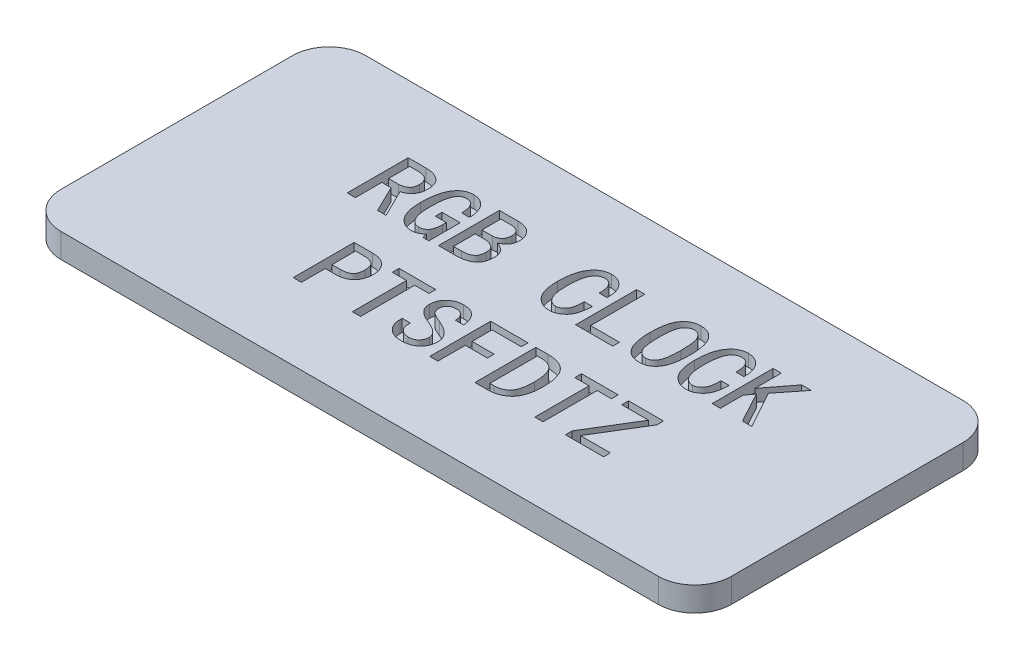
from build123d import *

# Parameters (mm, degrees)
EXTRUDE_1_DEPTH     = 4
CUT_EXTRUDE_1_DEPTH = 2
SKETCH_3_R          = 1.55
CUT_EXTRUDE_2_DEPTH = 2


with BuildPart() as part:
    # 草图1 → 凸台-拉伸1 (new body)
    with BuildSketch(Plane(origin=(0, 0, 0), x_dir=(1, 0, 0), z_dir=(0, 1, 0))):
        with BuildLine():
            Line((-49.060103211, -24.953020455), (48.939896789, -24.953020455))
            ThreePointArc((48.939896789, -24.953020455), (53.182537476, -23.195661143), (54.939896789, -18.953020455))
            Line((54.939896789, -18.953020455), (54.939896789, 19.046979545))
            ThreePointArc((54.939896789, 19.046979545), (53.182537476, 23.289620232), (48.939896789, 25.046979545))
            Line((48.939896789, 25.046979545), (-49.060103211, 25.046979545))
            ThreePointArc((-49.060103211, 25.046979545), (-53.302743898, 23.289620232), (-55.060103211, 19.046979545))
            Line((-55.060103211, 19.046979545), (-55.060103211, -18.953020455))
            ThreePointArc((-55.060103211, -18.953020455), (-53.302743898, -23.195661143), (-49.060103211, -24.953020455))
        make_face()
    extrude(amount=EXTRUDE_1_DEPTH)

    # 草图2 → 切除-拉伸1 (cut)
    # profile 1 of 15: a face of its own
    with BuildSketch(Plane(origin=(0, 4, 0), x_dir=(1, 0, 0), z_dir=(0, 1, 0))):
        with BuildLine():
            Line((-24.689103402, 4.013286342), (-26.092612174, 4.013286342))
            Line((-26.092612174, 4.013286342), (-28.197875332, 8.340771722))
            Line((-28.197875332, 8.340771722), (-29.718343168, 8.340771722))
            Line((-29.718343168, 8.340771722), (-29.718343168, 4.013286342))
            Line((-29.718343168, 4.013286342), (-31.063372408, 4.013286342))
            Line((-31.063372408, 4.013286342), (-31.063372408, 14.013286342))
            Line((-31.063372408, 14.013286342), (-28.139395799, 14.013286342))
            add(Edge.make_bspline(
                [(-28.139395799, 14.013286342), (-28.025271199, 14.011022447), (-27.801665177, 14.006586764), (-27.474158532, 13.977305773), (-27.163811789, 13.922480888), (-26.869993583, 13.848543864), (-26.591122472, 13.757128365), (-26.330664058, 13.638152685), (-26.084604122, 13.502366925), (-25.856059717, 13.34436888), (-25.649198765, 13.162867164), (-25.468095095, 12.953694485), (-25.317506234, 12.71659107), (-25.19224016, 12.453536513), (-25.098862257, 12.163974849), (-25.028759565, 11.848745919), (-24.988061601, 11.506955486), (-24.983731739, 11.269910871), (-24.981501063, 11.147789266)],
                knots=[0, 0, 0, 0, 1.124851401, 2.203938021, 3.236923468, 4.227547377, 5.188384515, 6.124748074, 7.04535131, 7.955333121, 8.85768773, 9.750678987, 10.67246398, 11.61778816, 12.61462837, 13.664292026, 14.796680505, 16, 16, 16, 16], degree=3))
            add(Edge.make_bspline(
                [(-24.981501063, 11.147789266), (-24.982879235, 11.053132412), (-24.985568475, 10.868427619), (-25.014691702, 10.599897587), (-25.059459648, 10.347780009), (-25.122091088, 10.111878008), (-25.20381367, 9.892229091), (-25.306953951, 9.68976788), (-25.425462329, 9.502309698), (-25.607220143, 9.280192442), (-25.858260009, 9.03978442), (-26.186011564, 8.801825154), (-26.537419989, 8.621484855), (-26.787121493, 8.551180459), (-26.911325624, 8.516210319)],
                knots=[0, 0, 0, 0, 0.960252019, 1.873748618, 2.737466876, 3.556786617, 4.347431233, 5.110891588, 5.858830743, 6.593445102, 8.018399741, 9.372640647, 10.693124067, 12, 12, 12, 12], degree=3))
            Line((-26.911325624, 8.516210319), (-24.689103402, 4.013286342))
        make_face()
        with BuildLine():
            add(Edge.make_bspline(
                [(-26.326530302, 11.147789266), (-26.328534479, 11.214250313), (-26.332444587, 11.343914494), (-26.352988156, 11.533501173), (-26.392896046, 11.711592998), (-26.445391927, 11.879642896), (-26.519630989, 12.033952382), (-26.602039127, 12.180903159), (-26.706758189, 12.313205167), (-26.822926271, 12.438010916), (-26.958258394, 12.548784835), (-27.112075487, 12.645663856), (-27.28592479, 12.724656185), (-27.478483614, 12.789349783), (-27.689174032, 12.841491619), (-27.91960733, 12.87741334), (-28.169289215, 12.899287418), (-28.342221339, 12.901189847), (-28.43179346, 12.902175231)],
                knots=[0, 0, 0, 0, 1.018423225, 1.986923476, 2.915383729, 3.810714658, 4.676600435, 5.533969095, 6.385612358, 7.253966558, 8.141821118, 9.056210967, 10.031005151, 11.059229177, 12.164336364, 13.351610032, 14.628236891, 16, 16, 16, 16], degree=3))
            Line((-28.43179346, 12.902175231), (-29.718343168, 12.902175231))
            Line((-29.718343168, 12.902175231), (-29.718343168, 9.451882834))
            Line((-29.718343168, 9.451882834), (-28.080916267, 9.451882834))
            add(Edge.make_bspline(
                [(-28.080916267, 9.451882834), (-27.967162713, 9.456192603), (-27.744517212, 9.464627952), (-27.422963771, 9.538637856), (-27.122727476, 9.656901993), (-26.892686197, 9.794736061), (-26.726225717, 9.931497522), (-26.619535608, 10.055327959), (-26.52747784, 10.194651609), (-26.454418562, 10.352823259), (-26.395491566, 10.526910596), (-26.355058864, 10.718817973), (-26.33161966, 10.927724938), (-26.328268216, 11.072641731), (-26.326530302, 11.147789266)],
                knots=[0, 0, 0, 0, 1.47184772, 2.880791526, 4.249240139, 5.638178403, 6.335067569, 7.030952029, 7.746845966, 8.491482783, 9.28109559, 10.123026367, 11.02668324, 12, 12, 12, 12], degree=3))
        make_face(mode=Mode.SUBTRACT)
    # profile 2 of 15: a face of its own
    with BuildSketch(Plane(origin=(0, 4, 0), x_dir=(1, 0, 0), z_dir=(0, 1, 0))):
        with BuildLine():
            Line((-17.554600478, 3.896327278), (-18.548752525, 3.896327278))
            Line((-18.548752525, 3.896327278), (-18.724191121, 4.715040728))
            add(Edge.make_bspline(
                [(-18.724191121, 4.715040728), (-18.767152967, 4.657138884), (-18.854665698, 4.539193568), (-19.026038271, 4.386135142), (-19.226536717, 4.24628958), (-19.457565649, 4.124634124), (-19.708424871, 4.023547891), (-19.97477921, 3.949068451), (-20.252606224, 3.905489663), (-20.441606207, 3.899401816), (-20.537056618, 3.896327278)],
                knots=[0, 0, 0, 0, 0.837184115, 1.705333332, 2.658671207, 3.677307666, 4.736711015, 5.80083511, 6.889358663, 8, 8, 8, 8], degree=3))
            add(Edge.make_bspline(
                [(-20.537056618, 3.896327278), (-20.638393329, 3.899391095), (-20.839657805, 3.90547613), (-21.13618719, 3.962600689), (-21.425231964, 4.051279527), (-21.704153682, 4.178397868), (-21.976875627, 4.337911454), (-22.238279392, 4.537458024), (-22.493912412, 4.769441759), (-22.740767076, 5.036015722), (-22.966273141, 5.344424008), (-23.164784586, 5.695546473), (-23.32799682, 6.092111115), (-23.464059213, 6.529062097), (-23.566434359, 7.010010435), (-23.641434184, 7.532375234), (-23.686945452, 8.098107577), (-23.692223493, 8.489410749), (-23.694951355, 8.691648915)],
                knots=[0, 0, 0, 0, 0.758179789, 1.505818141, 2.253143624, 3.017869083, 3.795858856, 4.614441485, 5.475677495, 6.378750386, 7.330399785, 8.330312341, 9.391702904, 10.535751225, 11.753218739, 13.069914954, 14.485637047, 16, 16, 16, 16], degree=3))
            add(Edge.make_bspline(
                [(-23.694951355, 8.691648915), (-23.692775035, 8.913359196), (-23.688560111, 9.342750131), (-23.64721628, 9.965234327), (-23.578680878, 10.543660505), (-23.484728573, 11.078660128), (-23.362347657, 11.569958556), (-23.210680663, 12.017543399), (-23.03499896, 12.423166267), (-22.827454191, 12.782962495), (-22.597994066, 13.100142258), (-22.348366649, 13.377015533), (-22.074672425, 13.607010018), (-21.78531097, 13.801514937), (-21.472128306, 13.950116449), (-21.138594106, 14.052909771), (-20.785784046, 14.118253452), (-20.543847628, 14.126187271), (-20.420097554, 14.130245407)],
                knots=[0, 0, 0, 0, 1.495213205, 2.895810661, 4.205263949, 5.422164245, 6.557127206, 7.616570214, 8.606403325, 9.533523062, 10.412081511, 11.242765381, 12.040838916, 12.817408929, 13.588463244, 14.369296309, 15.165897781, 16, 16, 16, 16], degree=3))
            add(Edge.make_bspline(
                [(-20.420097554, 14.130245407), (-20.31089217, 14.127663594), (-20.097162626, 14.122610641), (-19.786366853, 14.073459764), (-19.493509176, 13.995694028), (-19.219088008, 13.887269168), (-18.962659104, 13.747353038), (-18.72579707, 13.575140885), (-18.507153532, 13.371322521), (-18.309367476, 13.137789323), (-18.133200876, 12.879637721), (-17.975218896, 12.604203803), (-17.846062031, 12.30800801), (-17.74010364, 11.994015887), (-17.654617307, 11.662735271), (-17.59835451, 11.31172633), (-17.559219047, 10.943636818), (-17.5561611, 10.691613794), (-17.554600478, 10.562993945)],
                knots=[0, 0, 0, 0, 1.017118894, 1.990637724, 2.924249984, 3.836374462, 4.733711419, 5.639510097, 6.558385009, 7.513001497, 8.485403533, 9.467718841, 10.467915617, 11.491402174, 12.553806325, 13.652248568, 14.801825996, 16, 16, 16, 16], degree=3))
            Line((-17.554600478, 10.562993945), (-18.841150185, 10.562993945))
            add(Edge.make_bspline(
                [(-18.841150185, 10.562993945), (-18.842363108, 10.661930975), (-18.844720629, 10.85423176), (-18.863804287, 11.132682661), (-18.897198766, 11.391969265), (-18.93808892, 11.632983599), (-18.997993791, 11.853819189), (-19.065367542, 12.057291794), (-19.150825297, 12.239282085), (-19.246302474, 12.403821723), (-19.353749221, 12.549263379), (-19.474823059, 12.674131444), (-19.60470689, 12.780583427), (-19.745711067, 12.869918008), (-19.899633309, 12.936018558), (-20.064161926, 12.983347825), (-20.238343238, 13.015685969), (-20.358578166, 13.017967121), (-20.420097554, 13.019134295)],
                knots=[0, 0, 0, 0, 1.442265648, 2.803286258, 4.065667754, 5.252751118, 6.363271917, 7.39841691, 8.373155808, 9.288343585, 10.168233039, 11.001900497, 11.817228588, 12.611567034, 13.426963055, 14.24959516, 15.104388078, 16, 16, 16, 16], degree=3))
            add(Edge.make_bspline(
                [(-20.420097554, 13.019134295), (-20.496165279, 13.016475256), (-20.643973815, 13.01130843), (-20.858556196, 12.963471092), (-21.058133515, 12.888294549), (-21.244108224, 12.782016552), (-21.414089428, 12.644794379), (-21.565250849, 12.473769415), (-21.708667994, 12.278701694), (-21.830654541, 12.046958379), (-21.942976861, 11.783382142), (-22.033227521, 11.47812312), (-22.116843033, 11.134570334), (-22.178593872, 10.747554505), (-22.231981468, 10.321509925), (-22.263135649, 9.853622017), (-22.289623969, 9.345330453), (-22.290821078, 8.992031024), (-22.291442583, 8.80860798)],
                knots=[0, 0, 0, 0, 0.713867664, 1.387128832, 2.054865043, 2.71116651, 3.391329963, 4.097256694, 4.850367561, 5.660840087, 6.551597142, 7.538616976, 8.647598492, 9.872123473, 11.218389466, 12.680914074, 14.276824714, 16, 16, 16, 16], degree=3))
            add(Edge.make_bspline(
                [(-22.291442583, 8.80860798), (-22.290155165, 8.635285666), (-22.287680366, 8.302108701), (-22.258608598, 7.823795567), (-22.215470736, 7.386770889), (-22.149669982, 6.993019323), (-22.07279778, 6.639037643), (-21.970334675, 6.328439459), (-21.853553436, 6.057481419), (-21.714391982, 5.828599149), (-21.563744754, 5.635958998), (-21.408798862, 5.469021681), (-21.248920538, 5.327437881), (-21.082454741, 5.211380418), (-20.91122122, 5.117991053), (-20.731516153, 5.056470315), (-20.548356839, 5.014666672), (-20.423937094, 5.009850635), (-20.361618022, 5.007438389)],
                knots=[0, 0, 0, 0, 1.763137318, 3.38927359, 4.873732177, 6.228632264, 7.449226689, 8.554896297, 9.551299921, 10.444451664, 11.27164773, 12.035603122, 12.759076972, 13.439665674, 14.096862192, 14.735741838, 15.366761318, 16, 16, 16, 16], degree=3))
            add(Edge.make_bspline(
                [(-20.361618022, 5.007438389), (-20.300158704, 5.009046757), (-20.179558496, 5.012202821), (-20.003759679, 5.038580972), (-19.837428873, 5.082083371), (-19.680867947, 5.142563078), (-19.534641443, 5.221122415), (-19.399242701, 5.31709912), (-19.275148506, 5.431456974), (-19.159348015, 5.561994511), (-19.055468567, 5.711367649), (-18.965990888, 5.880988719), (-18.890810411, 6.069064205), (-18.830674499, 6.276756235), (-18.783288112, 6.502688278), (-18.749611337, 6.747306991), (-18.726881054, 7.011199123), (-18.725110263, 7.193510252), (-18.724191121, 7.288140143)],
                knots=[0, 0, 0, 0, 0.926763241, 1.818566216, 2.674466499, 3.515830513, 4.344194496, 5.172200422, 6.012506428, 6.88440238, 7.799833367, 8.749917039, 9.771239203, 10.849892544, 12.007626437, 13.250589984, 14.572899121, 16, 16, 16, 16], degree=3))
            Line((-18.724191121, 7.288140143), (-18.724191121, 7.931414997))
            Line((-18.724191121, 7.931414997), (-20.537056618, 7.931414997))
            Line((-20.537056618, 7.931414997), (-20.537056618, 9.042526108))
            Line((-20.537056618, 9.042526108), (-17.554600478, 9.042526108))
            Line((-17.554600478, 9.042526108), (-17.554600478, 3.896327278))
        make_face()
    # profile 3 of 15: a face of its own
    with BuildSketch(Plane(origin=(0, 4, 0), x_dir=(1, 0, 0), z_dir=(0, 1, 0))):
        with BuildLine():
            add(Edge.make_bspline(
                [(-9.835302232, 6.995742483), (-9.838194545, 6.85989788), (-9.843764271, 6.598301901), (-9.886592254, 6.221845414), (-9.959392997, 5.878528129), (-10.060927464, 5.566871403), (-10.192620119, 5.288245647), (-10.354225391, 5.041581354), (-10.546643994, 4.829109441), (-10.768818301, 4.650863131), (-11.012354988, 4.500979148), (-11.271908085, 4.370041181), (-11.548147256, 4.259756781), (-11.840570881, 4.168605671), (-12.150073724, 4.099813668), (-12.475002148, 4.050625702), (-12.816438977, 4.019585569), (-13.04944295, 4.015418167), (-13.168635566, 4.013286342)],
                knots=[0, 0, 0, 0, 1.267846684, 2.441492613, 3.530660021, 4.538682374, 5.494247056, 6.398907173, 7.281535974, 8.158279141, 9.048363337, 9.946498621, 10.868808668, 11.821612697, 12.802576615, 13.825270339, 14.887522325, 16, 16, 16, 16], degree=3))
            Line((-13.168635566, 4.013286342), (-16.092612174, 4.013286342))
            Line((-16.092612174, 4.013286342), (-16.092612174, 14.013286342))
            Line((-16.092612174, 14.013286342), (-13.051676501, 14.013286342))
            add(Edge.make_bspline(
                [(-13.051676501, 14.013286342), (-12.93386989, 14.011787269), (-12.70485588, 14.008873096), (-12.372790656, 13.969705744), (-12.061747202, 13.914150165), (-11.775034516, 13.828427511), (-11.51073713, 13.723106537), (-11.269415541, 13.592361509), (-11.052481177, 13.435089961), (-10.856970566, 13.257760495), (-10.687635158, 13.061853055), (-10.536590849, 12.85864962), (-10.410401534, 12.644173901), (-10.305496411, 12.422138397), (-10.228154288, 12.188849476), (-10.168536596, 11.948038315), (-10.133458665, 11.696798894), (-10.129630325, 11.526207356), (-10.127699893, 11.440186927)],
                knots=[0, 0, 0, 0, 1.287066508, 2.502034969, 3.650589526, 4.73690624, 5.767219852, 6.756134895, 7.72866321, 8.689593449, 9.634739393, 10.555042113, 11.453806091, 12.350662122, 13.234188154, 14.135789212, 15.059975582, 16, 16, 16, 16], degree=3))
            add(Edge.make_bspline(
                [(-10.127699893, 11.440186927), (-10.129721519, 11.355689627), (-10.133650541, 11.191469402), (-10.153593265, 10.953642681), (-10.193768185, 10.73304651), (-10.245549209, 10.528952583), (-10.319435838, 10.343823652), (-10.401599595, 10.173101795), (-10.505561269, 10.022151827), (-10.65921891, 9.847786058), (-10.866689042, 9.663067585), (-11.119538263, 9.472046624), (-11.378852299, 9.321025488), (-11.559776513, 9.251789978), (-11.648167729, 9.217964705)],
                knots=[0, 0, 0, 0, 1.04760564, 2.036018126, 2.954074521, 3.824490448, 4.640440018, 5.420823229, 6.16791628, 6.903668626, 8.297191749, 9.601918327, 10.828408033, 12, 12, 12, 12], degree=3))
            add(Edge.make_bspline(
                [(-11.648167729, 9.217964705), (-11.532720987, 9.184783362), (-11.301593202, 9.118353335), (-10.977244338, 8.951804406), (-10.668433447, 8.745472829), (-10.432745001, 8.533986822), (-10.259574641, 8.343794331), (-10.146324647, 8.185724437), (-10.048202855, 8.017418993), (-9.970006563, 7.83535827), (-9.909597457, 7.642205313), (-9.866371104, 7.436987839), (-9.840036599, 7.220241436), (-9.836902482, 7.071624708), (-9.835302232, 6.995742483)],
                knots=[0, 0, 0, 0, 1.389411127, 2.781642068, 4.204448348, 5.686136108, 6.438796724, 7.18204725, 7.935637767, 8.692751486, 9.473544937, 10.277799876, 11.120661721, 12, 12, 12, 12], degree=3))
        make_face()
        with BuildLine():
            add(Edge.make_bspline(
                [(-11.472729133, 11.440186927), (-11.473677168, 11.501631584), (-11.475512798, 11.620603508), (-11.498094943, 11.792301519), (-11.532056634, 11.951289247), (-11.579856698, 12.097230079), (-11.63992816, 12.231317642), (-11.717568897, 12.35084035), (-11.805222728, 12.46105631), (-11.946242633, 12.583157261), (-12.140661178, 12.713110476), (-12.401991068, 12.824317478), (-12.68954145, 12.890989217), (-12.889585401, 12.898358405), (-12.993196969, 12.902175231)],
                knots=[0, 0, 0, 0, 0.92281752, 1.786801034, 2.59764664, 3.362777658, 4.09101673, 4.798345046, 5.499908023, 6.199117884, 7.592393084, 8.997112214, 10.444672235, 12, 12, 12, 12], degree=3))
            Line((-12.993196969, 12.902175231), (-14.747582934, 12.902175231))
            Line((-14.747582934, 12.902175231), (-14.747582934, 9.802760026))
            Line((-14.747582934, 9.802760026), (-13.051676501, 9.802760026))
            add(Edge.make_bspline(
                [(-13.051676501, 9.802760026), (-12.947993866, 9.807099138), (-12.744545963, 9.81561342), (-12.451512586, 9.889667278), (-12.179539995, 10.007799289), (-11.97413085, 10.146863385), (-11.827853574, 10.283209789), (-11.730520384, 10.401969028), (-11.650566723, 10.537443567), (-11.586056673, 10.68853639), (-11.533287766, 10.854413106), (-11.497836352, 11.036077892), (-11.47549494, 11.23314114), (-11.473675165, 11.369367813), (-11.472729133, 11.440186927)],
                knots=[0, 0, 0, 0, 1.441874533, 2.829271733, 4.179753635, 5.554453541, 6.258546225, 6.958824609, 7.684686821, 8.441096196, 9.242341634, 10.103942696, 11.014311258, 12, 12, 12, 12], degree=3))
        make_face(mode=Mode.SUBTRACT)
        with BuildLine():
            add(Edge.make_bspline(
                [(-11.238811004, 6.995742483), (-11.239912085, 7.070960781), (-11.242039541, 7.21629395), (-11.274164847, 7.425014661), (-11.320306295, 7.617376115), (-11.387923964, 7.792178904), (-11.474054047, 7.949999324), (-11.582943139, 8.087393825), (-11.706764682, 8.211790304), (-11.901927063, 8.346576266), (-12.165895596, 8.484288247), (-12.503264065, 8.604875771), (-12.859343395, 8.67847292), (-13.103309137, 8.687213374), (-13.227115098, 8.691648915)],
                knots=[0, 0, 0, 0, 0.912723127, 1.763519616, 2.559004389, 3.311411928, 4.033728617, 4.733658355, 5.434411701, 6.157207363, 7.604739237, 9.038819807, 10.497281799, 12, 12, 12, 12], degree=3))
            Line((-13.227115098, 8.691648915), (-14.747582934, 8.691648915))
            Line((-14.747582934, 8.691648915), (-14.747582934, 5.124397453))
            Line((-14.747582934, 5.124397453), (-13.402553694, 5.124397453))
            add(Edge.make_bspline(
                [(-13.402553694, 5.124397453), (-13.317329578, 5.12560666), (-13.151699907, 5.127956704), (-12.911441627, 5.147132179), (-12.686848796, 5.180718894), (-12.476626722, 5.221334944), (-12.283491118, 5.281859176), (-12.104060745, 5.348688208), (-11.943485361, 5.435946527), (-11.793747762, 5.529362382), (-11.661921211, 5.64367801), (-11.547887431, 5.778341519), (-11.450612186, 5.931978316), (-11.372018686, 6.106373076), (-11.311772384, 6.300656978), (-11.26971215, 6.51486888), (-11.243160195, 6.748887573), (-11.240300593, 6.911195192), (-11.238811004, 6.995742483)],
                knots=[0, 0, 0, 0, 1.236269754, 2.402640959, 3.492788655, 4.530086063, 5.504175827, 6.426079895, 7.302166142, 8.150453208, 8.982023619, 9.821536747, 10.701932101, 11.611196492, 12.588378165, 13.646199445, 14.773887145, 16, 16, 16, 16], degree=3))
        make_face(mode=Mode.SUBTRACT)
    # profile 4 of 15: a face of its own
    with BuildSketch(Plane(origin=(0, 4, 0), x_dir=(1, 0, 0), z_dir=(0, 1, 0))):
        with BuildLine():
            add(Edge.make_bspline(
                [(5.193937534, 7.989894529), (5.186438907, 7.811448015), (5.171959697, 7.466882999), (5.120498776, 6.9705436), (5.043781807, 6.514347834), (4.940446892, 6.098291311), (4.811120762, 5.72153954), (4.656056989, 5.383689447), (4.473924981, 5.086519007), (4.265937862, 4.830449595), (4.038311786, 4.612583624), (3.802711299, 4.419821618), (3.554085419, 4.259838711), (3.296556983, 4.124255767), (3.025088993, 4.024223909), (2.74400416, 3.949181454), (2.451825675, 3.90538099), (2.2534984, 3.899372105), (2.153001861, 3.896327278)],
                knots=[0, 0, 0, 0, 1.494742256, 2.886219951, 4.173809575, 5.363956482, 6.470526693, 7.503352352, 8.469361244, 9.380145438, 10.256246157, 11.102836884, 11.924181916, 12.726930422, 13.533966696, 14.340165361, 15.1589274, 16, 16, 16, 16], degree=3))
            add(Edge.make_bspline(
                [(2.153001861, 3.896327278), (2.037975229, 3.899344221), (1.810936407, 3.905299043), (1.47768681, 3.962049492), (1.156127946, 4.050306928), (0.848810871, 4.17718289), (0.552144418, 4.33650667), (0.270919407, 4.534494), (0.003765836, 4.769431276), (-0.254028755, 5.03497626), (-0.488915245, 5.342875043), (-0.690450367, 5.696004161), (-0.86242027, 6.090829452), (-0.998228535, 6.529437718), (-1.106984084, 7.009527858), (-1.182784795, 7.53237258), (-1.231497194, 8.097986922), (-1.236319208, 8.489389838), (-1.238811004, 8.691648915)],
                knots=[0, 0, 0, 0, 0.834912197, 1.647944286, 2.448293278, 3.25272125, 4.057593572, 4.889800151, 5.744779857, 6.638682353, 7.574302, 8.549391203, 9.585101031, 10.696366523, 11.879553958, 13.157474301, 14.531113079, 16, 16, 16, 16], degree=3))
            add(Edge.make_bspline(
                [(-1.238811004, 8.691648915), (-1.23607727, 8.913372014), (-1.23078173, 9.342873845), (-1.185148542, 9.965526019), (-1.109858917, 10.544003184), (-1.008350414, 11.079756566), (-0.87106408, 11.570284924), (-0.708486335, 12.019849563), (-0.511198058, 12.423974946), (-0.28497315, 12.784771452), (-0.033200869, 13.099688758), (0.23341388, 13.377227808), (0.522264616, 13.606800332), (0.824452623, 13.801373838), (1.147128022, 13.948848652), (1.487139584, 14.053415767), (1.843737422, 14.11774088), (2.087756942, 14.126038361), (2.211481393, 14.130245407)],
                knots=[0, 0, 0, 0, 1.47527999, 2.857778281, 4.151479961, 5.355606635, 6.48275776, 7.537632238, 8.53243139, 9.469452065, 10.365307734, 11.211246795, 12.024566517, 12.814930656, 13.597414655, 14.376958224, 15.177074222, 16, 16, 16, 16], degree=3))
            add(Edge.make_bspline(
                [(2.211481393, 14.130245407), (2.316333332, 14.127427815), (2.522720891, 14.121881749), (2.825577419, 14.075164097), (3.114299402, 13.999208767), (3.390575344, 13.895283597), (3.651517099, 13.757180092), (3.898850736, 13.589812413), (4.132978686, 13.392766755), (4.350302156, 13.166485793), (4.547510694, 12.912795459), (4.72061961, 12.634400922), (4.86051848, 12.328816187), (4.973737524, 11.99947945), (5.057388796, 11.645336434), (5.112868122, 11.267123111), (5.141649037, 10.86449439), (5.137562792, 10.588300205), (5.135458002, 10.44603488)],
                knots=[0, 0, 0, 0, 0.945956135, 1.861993012, 2.758160538, 3.636767115, 4.519928897, 5.416356982, 6.327443843, 7.276805287, 8.242661636, 9.222809965, 10.22861537, 11.269278515, 12.361406108, 13.507821131, 14.716299423, 16, 16, 16, 16], degree=3))
            Line((5.135458002, 10.44603488), (3.848908294, 10.44603488))
            add(Edge.make_bspline(
                [(3.848908294, 10.44603488), (3.847740787, 10.550027536), (3.845484638, 10.750988115), (3.825915524, 11.043091219), (3.793131163, 11.314703168), (3.752240805, 11.567267755), (3.691541572, 11.79797433), (3.62517174, 12.011072207), (3.539071659, 12.202177043), (3.44436999, 12.375057639), (3.336243847, 12.527847448), (3.2135416, 12.659356714), (3.078138605, 12.770829981), (2.930012106, 12.863049492), (2.767541104, 12.932351912), (2.593575928, 12.981731789), (2.406805554, 13.013080685), (2.278031786, 13.017071723), (2.211481393, 13.019134295)],
                knots=[0, 0, 0, 0, 1.447060158, 2.796371029, 4.07121282, 5.253842581, 6.352813545, 7.388565209, 8.355623335, 9.26412738, 10.128389993, 10.952966403, 11.759535034, 12.562529072, 13.372531918, 14.208837792, 15.074325855, 16, 16, 16, 16], degree=3))
            add(Edge.make_bspline(
                [(2.211481393, 13.019134295), (2.135450492, 13.016297216), (1.985593661, 13.010705336), (1.767141619, 12.9640811), (1.561388875, 12.88682786), (1.365590633, 12.782153308), (1.183186623, 12.644002886), (1.01397119, 12.47558078), (0.85670525, 12.277712608), (0.710962243, 12.049059075), (0.580491093, 11.784295885), (0.46814977, 11.480106258), (0.374351641, 11.134895527), (0.297272284, 10.748379205), (0.237697311, 10.321647655), (0.195111679, 9.854015214), (0.169202318, 9.345325705), (0.166237107, 8.99202049), (0.164697768, 8.80860798)],
                knots=[0, 0, 0, 0, 0.702271953, 1.384177325, 2.053558723, 2.728373715, 3.429090246, 4.160530408, 4.929691837, 5.760909872, 6.662226506, 7.652627398, 8.753591582, 9.965523965, 11.293414481, 12.734409524, 14.304723168, 16, 16, 16, 16], degree=3))
            add(Edge.make_bspline(
                [(0.164697768, 8.80860798), (0.166235961, 8.639632505), (0.169196006, 8.314461967), (0.195044452, 7.846877412), (0.237718589, 7.418196913), (0.296900943, 7.02884105), (0.374617593, 6.677726436), (0.468147718, 6.365494141), (0.580172315, 6.091939507), (0.711224445, 5.856764754), (0.857967964, 5.656994713), (1.012303983, 5.483197694), (1.177702955, 5.337449261), (1.35232219, 5.216235714), (1.538203001, 5.122283656), (1.734021367, 5.054618057), (1.940561626, 5.014622797), (2.081351955, 5.009861481), (2.153001861, 5.007438389)],
                knots=[0, 0, 0, 0, 1.695965335, 3.263656815, 4.698586284, 6.018671717, 7.214194339, 8.305339643, 9.286425595, 10.175404576, 11.000155583, 11.769871946, 12.504076626, 13.207599708, 13.897898414, 14.587702459, 15.281264647, 16, 16, 16, 16], degree=3))
            add(Edge.make_bspline(
                [(2.153001861, 5.007438389), (2.205868793, 5.008730468), (2.311775463, 5.011318848), (2.467793217, 5.044041626), (2.621271982, 5.091618585), (2.770916567, 5.158429629), (2.91434546, 5.247653256), (3.057130305, 5.350941364), (3.191739295, 5.479061597), (3.329426391, 5.620935827), (3.455342762, 5.794724438), (3.559355959, 6.005704027), (3.650967883, 6.249997066), (3.721893618, 6.53001939), (3.781173091, 6.844521413), (3.820532492, 7.194884178), (3.843902611, 7.580936654), (3.847193479, 7.849796359), (3.848908294, 7.989894529)],
                knots=[0, 0, 0, 0, 0.660928196, 1.324016798, 1.987351856, 2.671191622, 3.368874025, 4.099346338, 4.873489474, 5.6921189, 6.572789567, 7.547167455, 8.628526434, 9.834544533, 11.159025956, 12.633584625, 14.245818809, 16, 16, 16, 16], degree=3))
            Line((3.848908294, 7.989894529), (5.193937534, 7.989894529))
        make_face()
    # profile 5 of 15: a face of its own
    with BuildSketch(Plane(origin=(0, 4, 0), x_dir=(1, 0, 0), z_dir=(0, 1, 0))):
        Polygon((12.503879054, 4.013286342), (6.422007709, 4.013286342), (6.422007709, 14.013286342), (7.767036949, 14.013286342), (7.767036949, 5.124397453), (12.503879054, 5.124397453), align=None)
    # profile 6 of 15: a face of its own
    with BuildSketch(Plane(origin=(0, 4, 0), x_dir=(1, 0, 0), z_dir=(0, 1, 0))):
        with BuildLine():
            add(Edge.make_bspline(
                [(20.106218236, 9.042526108), (20.10384304, 8.82154901), (20.099259416, 8.395110033), (20.061048368, 7.779780823), (19.994477885, 7.212863647), (19.902582689, 6.693878072), (19.784794416, 6.222812423), (19.640839808, 5.799192567), (19.4678618, 5.424148305), (19.267623492, 5.095671733), (19.042546241, 4.812214536), (18.798322874, 4.566381125), (18.53203891, 4.358852053), (18.244793783, 4.188610525), (17.93570772, 4.057658943), (17.606089479, 3.964878524), (17.255004493, 3.907253143), (17.013526559, 3.90002795), (16.889843967, 3.896327278)],
                knots=[0, 0, 0, 0, 1.545836505, 2.983136913, 4.310657039, 5.537175887, 6.667851947, 7.704493515, 8.662599122, 9.55136463, 10.389079191, 11.189082316, 11.970061338, 12.744463405, 13.518420627, 14.311409556, 15.135120791, 16, 16, 16, 16], degree=3))
            add(Edge.make_bspline(
                [(16.889843967, 3.896327278), (16.766155688, 3.899999817), (16.524666653, 3.907170084), (16.172286058, 3.965414788), (15.83980734, 4.057727141), (15.526651837, 4.187873455), (15.236359967, 4.360063352), (14.964119697, 4.566009882), (14.713408714, 4.81196369), (14.481949156, 5.095379902), (14.274516612, 5.423197336), (14.09828434, 5.799472316), (13.946495967, 6.222081128), (13.824711572, 6.693548317), (13.731072746, 7.212805713), (13.662340053, 7.779711108), (13.621340526, 8.395032095), (13.617157524, 8.821538428), (13.614990165, 9.042526108)],
                knots=[0, 0, 0, 0, 0.860715957, 1.680462108, 2.47930714, 3.258798976, 4.033804958, 4.822976692, 5.629862064, 6.472991471, 7.365455267, 8.323231869, 9.359903903, 10.487649235, 11.709164083, 13.030896221, 14.461604659, 16, 16, 16, 16], degree=3))
            add(Edge.make_bspline(
                [(13.614990165, 9.042526108), (13.617146032, 9.263513625), (13.621299826, 9.689299215), (13.662297721, 10.303189515), (13.731177286, 10.867899329), (13.824066418, 11.383740682), (13.946815011, 11.850700215), (14.098433184, 12.268222264), (14.273260527, 12.639712374), (14.482784779, 12.959798613), (14.713316927, 13.236709257), (14.96499667, 13.475795774), (15.236366725, 13.677735254), (15.527398956, 13.844836763), (15.839828284, 13.973518797), (16.172655095, 14.062581596), (16.524558083, 14.122282408), (16.766130488, 14.127548532), (16.889843967, 14.130245407)],
                knots=[0, 0, 0, 0, 1.548230922, 2.98303917, 4.308200808, 5.532550635, 6.652834833, 7.686623778, 8.641401291, 9.522543054, 10.35935634, 11.160886009, 11.949022642, 12.72391454, 13.50644669, 14.309045162, 15.13403228, 16, 16, 16, 16], degree=3))
            add(Edge.make_bspline(
                [(16.889843967, 14.130245407), (17.013552165, 14.127521393), (17.255114259, 14.122202277), (17.605714604, 14.063113091), (17.935683784, 13.973584715), (18.244054599, 13.844113575), (18.532005914, 13.678934557), (18.797453074, 13.475451154), (19.042643281, 13.236454407), (19.26680431, 12.959528272), (19.469117469, 12.638721599), (19.640688929, 12.268508545), (19.784493379, 11.849968695), (19.90321192, 11.383400046), (19.994376882, 10.867842736), (20.061089034, 10.303118984), (20.099298052, 9.689221026), (20.103853596, 9.263503001), (20.106218236, 9.042526108)],
                knots=[0, 0, 0, 0, 0.870222972, 1.699263968, 2.496006616, 3.272995294, 4.047285334, 4.827112443, 5.621581463, 6.452817072, 7.330064346, 8.285160362, 9.318904812, 10.442120126, 11.67157227, 13.002634169, 14.444161275, 16, 16, 16, 16], degree=3))
        make_face()
        with BuildLine():
            add(Edge.make_bspline(
                [(18.702709464, 9.042526108), (18.700990675, 9.238204395), (18.697703932, 9.612388855), (18.674665679, 10.147054156), (18.634857545, 10.629245746), (18.576613991, 11.05859208), (18.505699833, 11.43637762), (18.415355164, 11.760392216), (18.311839283, 12.033327693), (18.185792324, 12.254596786), (18.046676855, 12.435510122), (17.905207663, 12.59208637), (17.754316375, 12.724315577), (17.594815406, 12.830306373), (17.430242769, 12.917149487), (17.255900966, 12.97473458), (17.075731566, 13.014255518), (16.952149361, 13.017499038), (16.889843967, 13.019134295)],
                knots=[0, 0, 0, 0, 1.935009416, 3.700208474, 5.290966952, 6.717666284, 7.983429577, 9.088666043, 10.040575683, 10.86236036, 11.596304304, 12.29363804, 12.946461271, 13.574167208, 14.184039162, 14.780089417, 15.384968011, 16, 16, 16, 16], degree=3))
            add(Edge.make_bspline(
                [(16.889843967, 13.019134295), (16.827544728, 13.017456159), (16.703266082, 13.014108501), (16.521662519, 12.974723578), (16.345147146, 12.917229582), (16.177964862, 12.829893724), (16.014519684, 12.723794132), (15.857049037, 12.593235908), (15.711708327, 12.434227604), (15.563067355, 12.256019626), (15.431154243, 12.033690242), (15.320146307, 11.761244346), (15.226449768, 11.436499845), (15.150262746, 11.058967181), (15.090779191, 10.629265188), (15.04864821, 10.14711815), (15.022895964, 9.61244164), (15.02000869, 9.23821099), (15.018498937, 9.042526108)],
                knots=[0, 0, 0, 0, 0.611089153, 1.219041108, 1.817987105, 2.430269109, 3.065779911, 3.730623558, 4.433151476, 5.17984647, 6.00710797, 6.960941472, 8.063026251, 9.323472721, 10.742001662, 12.323182839, 14.077395506, 16, 16, 16, 16], degree=3))
            add(Edge.make_bspline(
                [(15.018498937, 9.042526108), (15.020023698, 8.846842045), (15.022945293, 8.471891803), (15.048613211, 7.935766636), (15.090988558, 7.450765967), (15.150060986, 7.018135792), (15.2266219, 6.637042996), (15.32116741, 6.30770129), (15.430642639, 6.028258769), (15.563267666, 5.799192427), (15.710910984, 5.614184596), (15.857769823, 5.451018139), (16.013721105, 5.313789569), (16.177355901, 5.203079045), (16.345105665, 5.114040396), (16.521231551, 5.053316826), (16.703396568, 5.015347888), (16.827572984, 5.010080058), (16.889843967, 5.007438389)],
                knots=[0, 0, 0, 0, 1.904974992, 3.650122658, 5.223805484, 6.643247296, 7.899019683, 9.004487743, 9.975563022, 10.813390195, 11.569780086, 12.276151917, 12.948593274, 13.586073969, 14.195949674, 14.79168842, 15.394065703, 16, 16, 16, 16], degree=3))
            add(Edge.make_bspline(
                [(16.889843967, 5.007438389), (16.952120579, 5.010038891), (17.075600352, 5.015195071), (17.256336482, 5.053311169), (17.430282376, 5.114122525), (17.595442596, 5.202667573), (17.75514097, 5.313294706), (17.904444319, 5.452140933), (18.047508077, 5.612944063), (18.185549011, 5.800592989), (18.312331081, 6.028629874), (18.414362244, 6.308504831), (18.505535331, 6.637164435), (18.576805807, 7.018509998), (18.634655775, 7.45078369), (18.674700333, 7.935830487), (18.697657625, 8.471944243), (18.700976967, 8.846848559), (18.702709464, 9.042526108)],
                knots=[0, 0, 0, 0, 0.609746698, 1.208983301, 1.801799102, 2.40924424, 3.039088536, 3.699939805, 4.401261932, 5.145395336, 5.978015425, 6.947413619, 8.055962864, 9.316862112, 10.744271275, 12.327239227, 14.08303934, 16, 16, 16, 16], degree=3))
        make_face(mode=Mode.SUBTRACT)
    # profile 7 of 15: a face of its own
    with BuildSketch(Plane(origin=(0, 4, 0), x_dir=(1, 0, 0), z_dir=(0, 1, 0))):
        with BuildLine():
            add(Edge.make_bspline(
                [(27.650077885, 7.989894529), (27.642579258, 7.811448015), (27.628100048, 7.466882999), (27.576639127, 6.9705436), (27.499922158, 6.514347834), (27.396587243, 6.098291311), (27.267261113, 5.72153954), (27.11219734, 5.383689447), (26.930065332, 5.086519007), (26.722078213, 4.830449595), (26.494452137, 4.612583624), (26.258851649, 4.419821618), (26.01022577, 4.259838711), (25.752697333, 4.124255767), (25.481229344, 4.024223909), (25.200144511, 3.949181454), (24.907966026, 3.90538099), (24.709638751, 3.899372105), (24.609142212, 3.896327278)],
                knots=[0, 0, 0, 0, 1.494742256, 2.886219951, 4.173809575, 5.363956482, 6.470526693, 7.503352352, 8.469361244, 9.380145438, 10.256246157, 11.102836884, 11.924181916, 12.726930422, 13.533966696, 14.340165361, 15.1589274, 16, 16, 16, 16], degree=3))
            add(Edge.make_bspline(
                [(24.609142212, 3.896327278), (24.49411558, 3.899344221), (24.267076758, 3.905299043), (23.933827161, 3.962049492), (23.612268297, 4.050306928), (23.304951222, 4.17718289), (23.008284769, 4.33650667), (22.727059758, 4.534494), (22.459906187, 4.769431276), (22.202111596, 5.03497626), (21.967225106, 5.342875043), (21.765689984, 5.696004161), (21.593720081, 6.090829452), (21.457911816, 6.529437718), (21.349156267, 7.009527858), (21.273355556, 7.53237258), (21.224643156, 8.097986922), (21.219821142, 8.489389838), (21.217329347, 8.691648915)],
                knots=[0, 0, 0, 0, 0.834912197, 1.647944286, 2.448293278, 3.25272125, 4.057593572, 4.889800151, 5.744779857, 6.638682353, 7.574302, 8.549391203, 9.585101031, 10.696366523, 11.879553958, 13.157474301, 14.531113079, 16, 16, 16, 16], degree=3))
            add(Edge.make_bspline(
                [(21.217329347, 8.691648915), (21.220063081, 8.913372014), (21.225358621, 9.342873845), (21.270991809, 9.965526019), (21.346281434, 10.544003184), (21.447789937, 11.079756566), (21.585076271, 11.570284924), (21.747654016, 12.019849563), (21.944942293, 12.423974946), (22.171167201, 12.784771452), (22.422939482, 13.099688758), (22.689554231, 13.377227808), (22.978404967, 13.606800332), (23.280592974, 13.801373838), (23.603268373, 13.948848652), (23.943279935, 14.053415767), (24.299877773, 14.11774088), (24.543897293, 14.126038361), (24.667621744, 14.130245407)],
                knots=[0, 0, 0, 0, 1.47527999, 2.857778281, 4.151479961, 5.355606635, 6.48275776, 7.537632238, 8.53243139, 9.469452065, 10.365307734, 11.211246795, 12.024566517, 12.814930656, 13.597414655, 14.376958224, 15.177074222, 16, 16, 16, 16], degree=3))
            add(Edge.make_bspline(
                [(24.667621744, 14.130245407), (24.772473683, 14.127427815), (24.978861242, 14.121881749), (25.28171777, 14.075164097), (25.570439752, 13.999208767), (25.846715695, 13.895283597), (26.10765745, 13.757180092), (26.354991087, 13.589812413), (26.589119037, 13.392766755), (26.806442507, 13.166485793), (27.003651045, 12.912795459), (27.17675996, 12.634400922), (27.316658831, 12.328816187), (27.429877875, 11.99947945), (27.513529146, 11.645336434), (27.569008473, 11.267123111), (27.597789388, 10.86449439), (27.593703143, 10.588300205), (27.591598353, 10.44603488)],
                knots=[0, 0, 0, 0, 0.945956135, 1.861993012, 2.758160538, 3.636767115, 4.519928897, 5.416356982, 6.327443843, 7.276805287, 8.242661636, 9.222809965, 10.22861537, 11.269278515, 12.361406108, 13.507821131, 14.716299423, 16, 16, 16, 16], degree=3))
            Line((27.591598353, 10.44603488), (26.305048645, 10.44603488))
            add(Edge.make_bspline(
                [(26.305048645, 10.44603488), (26.303881138, 10.550027536), (26.301624989, 10.750988115), (26.282055875, 11.043091219), (26.249271513, 11.314703168), (26.208381156, 11.567267755), (26.147681923, 11.79797433), (26.081312091, 12.011072207), (25.99521201, 12.202177043), (25.900510341, 12.375057639), (25.792384198, 12.527847448), (25.669681951, 12.659356714), (25.534278956, 12.770829981), (25.386152457, 12.863049492), (25.223681455, 12.932351912), (25.049716279, 12.981731789), (24.862945905, 13.013080685), (24.734172137, 13.017071723), (24.667621744, 13.019134295)],
                knots=[0, 0, 0, 0, 1.447060158, 2.796371029, 4.07121282, 5.253842581, 6.352813545, 7.388565209, 8.355623335, 9.26412738, 10.128389993, 10.952966403, 11.759535034, 12.562529072, 13.372531918, 14.208837792, 15.074325855, 16, 16, 16, 16], degree=3))
            add(Edge.make_bspline(
                [(24.667621744, 13.019134295), (24.591590843, 13.016297216), (24.441734012, 13.010705336), (24.22328197, 12.9640811), (24.017529226, 12.88682786), (23.821730984, 12.782153308), (23.639326974, 12.644002886), (23.470111541, 12.47558078), (23.312845601, 12.277712608), (23.167102594, 12.049059075), (23.036631444, 11.784295885), (22.924290121, 11.480106258), (22.830491992, 11.134895527), (22.753412635, 10.748379205), (22.693837662, 10.321647655), (22.65125203, 9.854015214), (22.625342669, 9.345325705), (22.622377458, 8.99202049), (22.620838119, 8.80860798)],
                knots=[0, 0, 0, 0, 0.702271953, 1.384177325, 2.053558723, 2.728373715, 3.429090246, 4.160530408, 4.929691837, 5.760909872, 6.662226506, 7.652627398, 8.753591582, 9.965523965, 11.293414481, 12.734409524, 14.304723168, 16, 16, 16, 16], degree=3))
            add(Edge.make_bspline(
                [(22.620838119, 8.80860798), (22.622376312, 8.639632505), (22.625336357, 8.314461967), (22.651184803, 7.846877412), (22.69385894, 7.418196913), (22.753041294, 7.02884105), (22.830757943, 6.677726436), (22.924288069, 6.365494141), (23.036312666, 6.091939507), (23.167364796, 5.856764754), (23.314108314, 5.656994713), (23.468444334, 5.483197694), (23.633843306, 5.337449261), (23.808462541, 5.216235714), (23.994343352, 5.122283656), (24.190161718, 5.054618057), (24.396701977, 5.014622797), (24.537492306, 5.009861481), (24.609142212, 5.007438389)],
                knots=[0, 0, 0, 0, 1.695965335, 3.263656815, 4.698586284, 6.018671717, 7.214194339, 8.305339643, 9.286425595, 10.175404576, 11.000155583, 11.769871946, 12.504076626, 13.207599708, 13.897898414, 14.587702459, 15.281264647, 16, 16, 16, 16], degree=3))
            add(Edge.make_bspline(
                [(24.609142212, 5.007438389), (24.662009143, 5.008730468), (24.767915814, 5.011318848), (24.923933568, 5.044041626), (25.077412333, 5.091618585), (25.227056918, 5.158429629), (25.370485811, 5.247653256), (25.513270656, 5.350941364), (25.647879646, 5.479061597), (25.785566742, 5.620935827), (25.911483112, 5.794724438), (26.01549631, 6.005704027), (26.107108234, 6.249997066), (26.178033969, 6.53001939), (26.237313442, 6.844521413), (26.276672842, 7.194884178), (26.300042962, 7.580936654), (26.30333383, 7.849796359), (26.305048645, 7.989894529)],
                knots=[0, 0, 0, 0, 0.660928196, 1.324016798, 1.987351856, 2.671191622, 3.368874025, 4.099346338, 4.873489474, 5.6921189, 6.572789567, 7.547167455, 8.628526434, 9.834544533, 11.159025956, 12.633584625, 14.245818809, 16, 16, 16, 16], degree=3))
            Line((26.305048645, 7.989894529), (27.650077885, 7.989894529))
        make_face()
    # profile 8 of 15: a face of its own
    with BuildSketch(Plane(origin=(0, 4, 0), x_dir=(1, 0, 0), z_dir=(0, 1, 0))):
        Polygon((35.310896598, 4.013286342), (33.790428762, 4.013286342), (31.100370282, 8.984046576), (30.164697768, 7.755976401), (30.164697768, 4.013286342), (28.819668528, 4.013286342), (28.819668528, 14.013286342), (30.164697768, 14.013286342), (30.164697768, 9.685800962), (33.498031101, 14.013286342), (35.07697847, 14.013286342), (31.977563265, 10.095157687), align=None)
    # profile 9 of 15: a face of its own
    with BuildSketch(Plane(origin=(0, 4, 0), x_dir=(1, 0, 0), z_dir=(0, 1, 0))):
        with BuildLine():
            add(Edge.make_bspline(
                [(-17.320682349, -5.498409564), (-17.32296856, -5.612610933), (-17.327424865, -5.835213406), (-17.36816946, -6.159611128), (-17.42936502, -6.465972694), (-17.518777142, -6.755078049), (-17.6352034, -7.025121744), (-17.777773412, -7.276377791), (-17.942847144, -7.510999362), (-18.136200727, -7.72377731), (-18.349508623, -7.9185692), (-18.58829686, -8.08195868), (-18.843102974, -8.225450298), (-19.120751435, -8.339196453), (-19.416924655, -8.430997429), (-19.734409434, -8.492085792), (-20.070337627, -8.532558492), (-20.301568513, -8.537045298), (-20.420097554, -8.539345237)],
                knots=[0, 0, 0, 0, 1.113585954, 2.170613098, 3.184453455, 4.157933965, 5.11693774, 6.047298652, 6.971642075, 7.9092259, 8.846809724, 9.782672554, 10.725321584, 11.694538078, 12.703744356, 13.745194327, 14.844185754, 16, 16, 16, 16], degree=3))
            Line((-20.420097554, -8.539345237), (-22.116003987, -8.539345237))
            Line((-22.116003987, -8.539345237), (-22.116003987, -12.457473892))
            Line((-22.116003987, -12.457473892), (-23.461033226, -12.457473892))
            Line((-23.461033226, -12.457473892), (-23.461033226, -2.457473892))
            Line((-23.461033226, -2.457473892), (-20.420097554, -2.457473892))
            add(Edge.make_bspline(
                [(-20.420097554, -2.457473892), (-20.301576651, -2.459798652), (-20.070361638, -2.46433388), (-19.734320837, -2.504463079), (-19.417439518, -2.566724831), (-19.119783894, -2.65422392), (-18.84367971, -2.772068359), (-18.588209341, -2.914640629), (-18.349533533, -3.078309379), (-18.136188498, -3.273023593), (-17.94287096, -3.485833021), (-17.77769132, -3.720406717), (-17.63584109, -3.971247993), (-17.517792966, -4.24064639), (-17.429845867, -4.530286398), (-17.368071705, -4.837174895), (-17.327451282, -5.161614669), (-17.322977517, -5.384211229), (-17.320682349, -5.498409564)],
                knots=[0, 0, 0, 0, 1.155744957, 2.254670502, 3.296058039, 4.30316213, 5.275054544, 6.217647064, 7.153453791, 8.090981409, 9.028509026, 9.952797036, 10.883102175, 11.835587515, 12.815737448, 13.829517027, 14.886480804, 16, 16, 16, 16], degree=3))
        make_face()
        with BuildLine():
            add(Edge.make_bspline(
                [(-18.665711589, -5.498409564), (-18.667439659, -5.409553211), (-18.670761967, -5.238722069), (-18.694108869, -4.993132827), (-18.734282764, -4.768819936), (-18.793162459, -4.566661883), (-18.865032121, -4.384900832), (-18.958217484, -4.227308096), (-19.063251363, -4.088370582), (-19.190286222, -3.973910945), (-19.333730047, -3.879443038), (-19.489276308, -3.793587822), (-19.663760954, -3.725035017), (-19.85309864, -3.666018949), (-20.06023267, -3.624563084), (-20.282035968, -3.591379743), (-20.520833628, -3.572063865), (-20.685748261, -3.569770298), (-20.770974747, -3.568585003)],
                knots=[0, 0, 0, 0, 1.283231691, 2.467082286, 3.559210814, 4.568987994, 5.504250366, 6.37341159, 7.205635433, 8.010158275, 8.828615604, 9.682442496, 10.571210164, 11.531028497, 12.54333288, 13.618353121, 14.769185068, 16, 16, 16, 16], degree=3))
            Line((-20.770974747, -3.568585003), (-22.116003987, -3.568585003))
            Line((-22.116003987, -3.568585003), (-22.116003987, -7.428234126))
            Line((-22.116003987, -7.428234126), (-20.770974747, -7.428234126))
            add(Edge.make_bspline(
                [(-20.770974747, -7.428234126), (-20.685748261, -7.42704883), (-20.520833628, -7.424755264), (-20.282035968, -7.405439386), (-20.06023267, -7.372256044), (-19.85309864, -7.330800179), (-19.663760954, -7.271784111), (-19.489276308, -7.203231306), (-19.333730047, -7.11737609), (-19.190286222, -7.022908183), (-19.063251363, -6.908448547), (-18.958217484, -6.769511032), (-18.865032121, -6.611918296), (-18.793162459, -6.430157245), (-18.734282764, -6.227999192), (-18.694108869, -6.003686301), (-18.670761967, -5.758097059), (-18.667439659, -5.587265917), (-18.665711589, -5.498409564)],
                knots=[0, 0, 0, 0, 1.230814932, 2.381646879, 3.45666712, 4.468971503, 5.428789836, 6.317557504, 7.171384396, 7.989841725, 8.794364567, 9.62658841, 10.495749634, 11.431012006, 12.440789186, 13.532917714, 14.716768309, 16, 16, 16, 16], degree=3))
        make_face(mode=Mode.SUBTRACT)
    # profile 10 of 15: a face of its own
    with BuildSketch(Plane(origin=(0, 4, 0), x_dir=(1, 0, 0), z_dir=(0, 1, 0))):
        Polygon((-10.069220361, -3.568585003), (-12.408401647, -3.568585003), (-12.408401647, -12.457473892), (-13.753430887, -12.457473892), (-13.753430887, -3.568585003), (-16.092612174, -3.568585003), (-16.092612174, -2.457473892), (-10.069220361, -2.457473892), align=None)
    # profile 11 of 15: a face of its own
    with BuildSketch(Plane(origin=(0, 4, 0), x_dir=(1, 0, 0), z_dir=(0, 1, 0))):
        with BuildLine():
            add(Edge.make_bspline(
                [(-2.46688118, -9.650456348), (-2.46928618, -9.759588781), (-2.473984925, -9.972805202), (-2.513392437, -10.284815105), (-2.580054908, -10.579397569), (-2.673589048, -10.856747148), (-2.793158466, -11.116135222), (-2.939630097, -11.358935681), (-3.112962143, -11.584482208), (-3.312824747, -11.789949754), (-3.534075401, -11.974617827), (-3.776045493, -12.135450508), (-4.036942559, -12.272928976), (-4.318514728, -12.382789758), (-4.617771247, -12.469851578), (-4.936977955, -12.52958202), (-5.274454259, -12.566917802), (-5.50627232, -12.571890799), (-5.624775916, -12.574432956)],
                knots=[0, 0, 0, 0, 1.076144108, 2.102505996, 3.095825232, 4.050645424, 4.984196986, 5.907479825, 6.841845839, 7.783590996, 8.729097989, 9.679099523, 10.644246964, 11.632062862, 12.655232941, 13.713869879, 14.831347993, 16, 16, 16, 16], degree=3))
            add(Edge.make_bspline(
                [(-5.624775916, -12.574432956), (-5.743304982, -12.572133041), (-5.974535917, -12.567646281), (-6.310463765, -12.527173256), (-6.627949763, -12.46608604), (-6.924118669, -12.374281006), (-7.201782383, -12.260549197), (-7.456533672, -12.117006014), (-7.695524101, -11.953806701), (-7.907288541, -11.759029919), (-8.101601491, -11.551045385), (-8.265153075, -11.323514278), (-8.408301144, -11.086991543), (-8.522517063, -10.83573256), (-8.615408766, -10.573190928), (-8.676233448, -10.295899235), (-8.717300124, -10.006892716), (-8.72186674, -9.809438769), (-8.724191121, -9.70893588)],
                knots=[0, 0, 0, 0, 1.196538468, 2.33425201, 3.412396666, 4.457161548, 5.460527637, 6.436390177, 7.405227411, 8.375846278, 9.335670364, 10.274835003, 11.200142775, 12.12337999, 13.057237208, 14.007039654, 14.985594985, 16, 16, 16, 16], degree=3))
            Line((-8.724191121, -9.70893588), (-8.724191121, -9.299579155))
            Line((-8.724191121, -9.299579155), (-7.379161881, -9.299579155))
            Line((-7.379161881, -9.299579155), (-7.379161881, -9.650456348))
            add(Edge.make_bspline(
                [(-7.379161881, -9.650456348), (-7.377351693, -9.721267587), (-7.373813138, -9.859689374), (-7.350619613, -10.060723078), (-7.309194638, -10.249403531), (-7.251104774, -10.424371947), (-7.176748975, -10.587374713), (-7.085416332, -10.736765098), (-6.978844474, -10.875052937), (-6.814942409, -11.037033948), (-6.586132891, -11.204503144), (-6.287329737, -11.356935656), (-5.962575751, -11.445514787), (-5.738646841, -11.457319159), (-5.624775916, -11.463321845)],
                knots=[0, 0, 0, 0, 0.899937149, 1.759196843, 2.567308812, 3.350717544, 4.097934817, 4.839099816, 5.571408796, 6.31103876, 7.760779786, 9.155922253, 10.553747428, 12, 12, 12, 12], degree=3))
            add(Edge.make_bspline(
                [(-5.624775916, -11.463321845), (-5.549656264, -11.461307656), (-5.403435786, -11.457387036), (-5.191544614, -11.437260057), (-4.995213207, -11.397677684), (-4.814940094, -11.344346433), (-4.649585443, -11.274457561), (-4.501018268, -11.187870884), (-4.365665341, -11.087591795), (-4.212319421, -10.930842962), (-4.050714087, -10.712565529), (-3.913170854, -10.419342995), (-3.827250426, -10.101455742), (-3.817107993, -9.880596527), (-3.811910419, -9.767415412)],
                knots=[0, 0, 0, 0, 0.962219836, 1.872961855, 2.721515218, 3.522926727, 4.276799653, 5.014164922, 5.72050659, 6.426545665, 7.815246758, 9.175842648, 10.55273742, 12, 12, 12, 12], degree=3))
            add(Edge.make_bspline(
                [(-3.811910419, -9.767415412), (-3.813702791, -9.718944997), (-3.81725562, -9.62286721), (-3.842102734, -9.479636456), (-3.882784988, -9.339107731), (-3.942207128, -9.202305008), (-4.01720265, -9.068273613), (-4.107837399, -8.937034926), (-4.215211377, -8.808127352), (-4.384689927, -8.636832439), (-4.63802116, -8.430434238), (-4.990349972, -8.196736182), (-5.402262526, -7.976020452), (-5.701684549, -7.846846789), (-5.858694045, -7.779111319)],
                knots=[0, 0, 0, 0, 0.578251208, 1.146206319, 1.729632852, 2.320140678, 2.921792905, 3.559846951, 4.220588567, 4.921185791, 6.432399352, 8.109791427, 9.960070942, 12, 12, 12, 12], degree=3))
            add(Edge.make_bspline(
                [(-5.858694045, -7.779111319), (-5.97161367, -7.735068388), (-6.190878231, -7.649546906), (-6.50550645, -7.51309879), (-6.79595819, -7.373415975), (-7.060422869, -7.227388384), (-7.301861485, -7.081419696), (-7.517485293, -6.929300339), (-7.708016259, -6.77315204), (-7.87770122, -6.615307244), (-8.02080579, -6.447818735), (-8.148826614, -6.277578854), (-8.251843911, -6.095859518), (-8.339594143, -5.90955998), (-8.407584659, -5.715091238), (-8.453829443, -5.513047165), (-8.486764403, -5.303826913), (-8.489091402, -5.161382455), (-8.490272992, -5.089052839)],
                knots=[0, 0, 0, 0, 1.442788407, 2.80157118, 4.081608732, 5.277882525, 6.396683758, 7.438774622, 8.41600694, 9.327939604, 10.193066353, 11.035393571, 11.859457263, 12.674643564, 13.484648255, 14.306018334, 15.139839872, 16, 16, 16, 16], degree=3))
            add(Edge.make_bspline(
                [(-8.490272992, -5.089052839), (-8.487812604, -4.989302604), (-8.482979262, -4.793346967), (-8.443902787, -4.506410642), (-8.376419561, -4.234343909), (-8.283209446, -3.977063711), (-8.162802339, -3.734742749), (-8.017270219, -3.506446264), (-7.844997448, -3.292274342), (-7.646210714, -3.097623772), (-7.430182632, -2.921129846), (-7.203276359, -2.76369515), (-6.963701501, -2.633864332), (-6.714818753, -2.527356931), (-6.45731382, -2.441528682), (-6.188372942, -2.384728112), (-5.910405878, -2.345227574), (-5.720942065, -2.342101519), (-5.624775916, -2.340514827)],
                knots=[0, 0, 0, 0, 1.07870255, 2.119071136, 3.124805643, 4.105581286, 5.072990272, 6.045680189, 7.028691787, 8.039235481, 9.049145311, 10.043383937, 11.021887354, 11.990902522, 12.968844852, 13.952259623, 14.960628413, 16, 16, 16, 16], degree=3))
            add(Edge.make_bspline(
                [(-5.624775916, -2.340514827), (-5.502669262, -2.343709761), (-5.265679775, -2.349910617), (-4.923578178, -2.389361174), (-4.608093865, -2.461830575), (-4.318754672, -2.559976876), (-4.055824887, -2.689673597), (-3.817931219, -2.844449268), (-3.609562005, -3.032366689), (-3.428935519, -3.24477491), (-3.274170401, -3.473399647), (-3.135993866, -3.706722059), (-3.01815734, -3.94420506), (-2.925473968, -4.188532711), (-2.851619429, -4.436095156), (-2.795928119, -4.688429248), (-2.766311605, -4.946109162), (-2.761624941, -5.119309456), (-2.75927884, -5.206011903)],
                knots=[0, 0, 0, 0, 1.282260702, 2.488662931, 3.608602347, 4.675455947, 5.689164954, 6.679473553, 7.645844993, 8.624331637, 9.600024491, 10.541331786, 11.470286479, 12.379766298, 13.281599694, 14.181168015, 15.089509718, 16, 16, 16, 16], degree=3))
            Line((-2.75927884, -5.206011903), (-4.10430808, -5.206011903))
            add(Edge.make_bspline(
                [(-4.10430808, -5.206011903), (-4.100084279, -5.101115194), (-4.091735774, -4.893782854), (-4.153237561, -4.587643711), (-4.27371454, -4.298114773), (-4.418588873, -4.074844045), (-4.559809767, -3.911557712), (-4.680541515, -3.804689341), (-4.810357102, -3.713374933), (-4.9520603, -3.638034962), (-5.105011747, -3.580466784), (-5.269173733, -3.538953331), (-5.443596412, -3.515355607), (-5.563337927, -3.511885792), (-5.624775916, -3.510105471)],
                knots=[0, 0, 0, 0, 1.460207937, 2.886156602, 4.313065059, 5.813047609, 6.57660706, 7.318406664, 8.055956018, 8.78576476, 9.550717507, 10.329856714, 11.143068759, 12, 12, 12, 12], degree=3))
            add(Edge.make_bspline(
                [(-5.624775916, -3.510105471), (-5.73640811, -3.514110913), (-5.949227474, -3.521747024), (-6.250401716, -3.594974103), (-6.515985692, -3.714201748), (-6.740933118, -3.883206026), (-6.923870239, -4.090171059), (-7.054559469, -4.335478547), (-7.131374057, -4.61449473), (-7.140500536, -4.811320097), (-7.145243753, -4.913614243)],
                knots=[0, 0, 0, 0, 1.145558682, 2.183931547, 3.163371772, 4.117557764, 5.053569339, 5.979736134, 6.950027789, 8, 8, 8, 8], degree=3))
            add(Edge.make_bspline(
                [(-7.145243753, -4.913614243), (-7.141905903, -4.998484605), (-7.135366931, -5.164748836), (-7.071726086, -5.404453389), (-6.971405899, -5.626384411), (-6.852147307, -5.798196334), (-6.722771686, -5.926447766), (-6.593086562, -6.028102795), (-6.431737144, -6.133540211), (-6.238368739, -6.243678082), (-6.012460976, -6.356858955), (-5.75729619, -6.479469852), (-5.467814238, -6.601507819), (-5.263913751, -6.683476038), (-5.156939659, -6.72647974)],
                knots=[0, 0, 0, 0, 1.054277047, 2.065368358, 3.062471884, 4.074520743, 4.646282749, 5.323992781, 6.121378042, 7.042966294, 8.091677809, 9.265162139, 10.56519814, 12, 12, 12, 12], degree=3))
            add(Edge.make_bspline(
                [(-5.156939659, -6.72647974), (-5.052624033, -6.770436635), (-4.848015053, -6.856655506), (-4.552637595, -6.997332526), (-4.276604094, -7.146886189), (-4.017636359, -7.300026625), (-3.778617783, -7.461035348), (-3.557187012, -7.627832929), (-3.353180644, -7.800592816), (-3.168339233, -7.980590002), (-3.004010804, -8.16660248), (-2.858248715, -8.357406839), (-2.74007181, -8.558651201), (-2.638911013, -8.763403153), (-2.563220188, -8.97675724), (-2.506168188, -9.194582482), (-2.472978047, -9.420573525), (-2.468932815, -9.573099282), (-2.46688118, -9.650456348)],
                knots=[0, 0, 0, 0, 1.286245445, 2.522894961, 3.715884829, 4.852742623, 5.94040206, 6.988895921, 8.001566966, 8.976237793, 9.917821146, 10.82027623, 11.699651049, 12.565605398, 13.411626584, 14.267259483, 15.121199423, 16, 16, 16, 16], degree=3))
        make_face()
    # profile 12 of 15: a face of its own
    with BuildSketch(Plane(origin=(0, 4, 0), x_dir=(1, 0, 0), z_dir=(0, 1, 0))):
        Polygon((5.07697847, -3.568585003), (0.281656832, -3.568585003), (0.281656832, -6.843438804), (3.907387826, -6.843438804), (3.907387826, -7.954549915), (0.281656832, -7.954549915), (0.281656832, -12.457473892), (-1.063372408, -12.457473892), (-1.063372408, -2.457473892), (5.07697847, -2.457473892), align=None)
    # profile 13 of 15: a face of its own
    with BuildSketch(Plane(origin=(0, 4, 0), x_dir=(1, 0, 0), z_dir=(0, 1, 0))):
        with BuildLine():
            add(Edge.make_bspline(
                [(12.562358586, -7.486713658), (12.559521339, -7.702715124), (12.554045864, -8.119566438), (12.498598251, -8.720788182), (12.412726499, -9.274579857), (12.287214282, -9.779850071), (12.127728797, -10.237471148), (11.933796379, -10.648246589), (11.700802374, -11.010322607), (11.429494141, -11.321526835), (11.128998637, -11.5898909), (10.804761206, -11.822230678), (10.457359601, -12.021481042), (10.082515301, -12.17870855), (9.68568022, -12.30562195), (9.262392207, -12.392759363), (8.815400928, -12.448747615), (8.508675137, -12.454521461), (8.351832271, -12.457473892)],
                knots=[0, 0, 0, 0, 1.389524785, 2.681580087, 3.881416849, 4.992360851, 6.026729756, 6.995017906, 7.908603538, 8.787894915, 9.643211222, 10.495393011, 11.350494818, 12.214247491, 13.106065295, 14.027214329, 14.991224842, 16, 16, 16, 16], degree=3))
            Line((8.351832271, -12.457473892), (6.363528177, -12.457473892))
            Line((6.363528177, -12.457473892), (6.363528177, -2.457473892))
            Line((6.363528177, -2.457473892), (8.351832271, -2.457473892))
            add(Edge.make_bspline(
                [(8.351832271, -2.457473892), (8.526728986, -2.460132691), (8.865228989, -2.465278605), (9.354063543, -2.523642414), (9.807693153, -2.612631336), (10.226028587, -2.740463229), (10.609931006, -2.904320819), (10.956782412, -3.107822403), (11.27076043, -3.344364204), (11.546353962, -3.624076587), (11.790022426, -3.944274624), (11.998094314, -4.311946711), (12.171817538, -4.726377123), (12.318202136, -5.186213186), (12.425618534, -5.695177285), (12.504309281, -6.250170806), (12.555778907, -6.852585797), (12.560110091, -7.270011058), (12.562358586, -7.486713658)],
                knots=[0, 0, 0, 0, 1.107739609, 2.143950281, 3.114742919, 4.033667788, 4.910720376, 5.753428295, 6.576026955, 7.394480551, 8.23354201, 9.118765776, 10.063698003, 11.076506874, 12.172173314, 13.355526632, 14.627145244, 16, 16, 16, 16], degree=3))
        make_face()
        with BuildLine():
            add(Edge.make_bspline(
                [(11.158849815, -7.486713658), (11.156848957, -7.313398237), (11.152993487, -6.979435375), (11.121533312, -6.497682564), (11.06474642, -6.056100156), (10.991871092, -5.65346889), (10.891595582, -5.293115924), (10.774209497, -4.970992167), (10.631023845, -4.689423199), (10.465213061, -4.445247691), (10.275818489, -4.236817524), (10.065562419, -4.056903886), (9.833017638, -3.905505842), (9.578843737, -3.78010957), (9.302397016, -3.686442403), (9.005238109, -3.616354588), (8.685822967, -3.575100152), (8.465303106, -3.570798476), (8.351832271, -3.568585003)],
                knots=[0, 0, 0, 0, 1.50261862, 2.895407767, 4.182685949, 5.361245188, 6.439488336, 7.421939034, 8.328969596, 9.171036484, 9.973163414, 10.763455177, 11.563821661, 12.37285522, 13.214177287, 14.088724386, 15.01653284, 16, 16, 16, 16], degree=3))
            Line((8.351832271, -3.568585003), (7.708557417, -3.568585003))
            Line((7.708557417, -3.568585003), (7.708557417, -11.346362781))
            Line((7.708557417, -11.346362781), (8.351832271, -11.346362781))
            add(Edge.make_bspline(
                [(8.351832271, -11.346362781), (8.465283345, -11.343946662), (8.685674638, -11.339253084), (9.005109073, -11.300814545), (9.302331952, -11.232910651), (9.57824789, -11.141042481), (9.832244509, -11.020223307), (10.065287279, -10.875612447), (10.275709856, -10.702235972), (10.464325588, -10.50048265), (10.632336387, -10.264140615), (10.773963896, -9.987228973), (10.892117989, -9.668996048), (10.991511147, -9.311946781), (11.064839077, -8.913042686), (11.12177662, -8.474326326), (11.152951058, -7.993988596), (11.15683446, -7.660027936), (11.158849815, -7.486713658)],
                knots=[0, 0, 0, 0, 0.9908866, 1.924907101, 2.80462885, 3.650254363, 4.45990781, 5.256111711, 6.040209073, 6.834462288, 7.662189065, 8.564851509, 9.54291023, 10.623211397, 11.798270521, 13.082748796, 14.486045376, 16, 16, 16, 16], degree=3))
        make_face(mode=Mode.SUBTRACT)
    # profile 14 of 15: a face of its own
    with BuildSketch(Plane(origin=(0, 4, 0), x_dir=(1, 0, 0), z_dir=(0, 1, 0))):
        Polygon((19.872300107, -3.568585003), (17.53311882, -3.568585003), (17.53311882, -12.457473892), (16.188089581, -12.457473892), (16.188089581, -3.568585003), (13.848908294, -3.568585003), (13.848908294, -2.457473892), (19.872300107, -2.457473892), align=None)
    # profile 15 of 15: a face of its own
    with BuildSketch(Plane(origin=(0, 4, 0), x_dir=(1, 0, 0), z_dir=(0, 1, 0))):
        Polygon((27.474639288, -12.457473892), (21.217329347, -12.457473892), (21.217329347, -11.346362781), (25.954171452, -3.568585003), (21.56820654, -3.568585003), (21.56820654, -2.457473892), (27.299200692, -2.457473892), (27.299200692, -3.568585003), (22.562358586, -11.346362781), (27.474639288, -11.346362781), align=None)
    extrude(amount=-CUT_EXTRUDE_1_DEPTH, mode=Mode.SUBTRACT)

    # 草图3 → 切除-拉伸2 (cut)
    with BuildSketch(Plane.XZ):
        with Locations((-0.060103211, 22.653020455)):
            Circle(SKETCH_3_R)
        with Locations((19.939896789, 22.653020455)):
            Circle(SKETCH_3_R)
        with Locations((39.939896789, 22.653020455)):
            Circle(SKETCH_3_R)
        with Locations((-20.060103211, 22.653020455)):
            Circle(SKETCH_3_R)
        with Locations((-40.060103211, 22.653020455)):
            Circle(SKETCH_3_R)
        with Locations((-40.060103211, -22.653020455)):
            Circle(SKETCH_3_R)
        with Locations((-20.060103211, -22.653020455)):
            Circle(SKETCH_3_R)
        with Locations((39.939896789, -22.653020455)):
            Circle(SKETCH_3_R)
        with Locations((19.939896789, -22.653020455)):
            Circle(SKETCH_3_R)
        with Locations((-0.060103211, -22.653020455)):
            Circle(SKETCH_3_R)
    extrude(amount=-CUT_EXTRUDE_2_DEPTH, mode=Mode.SUBTRACT)


solid = part.part
